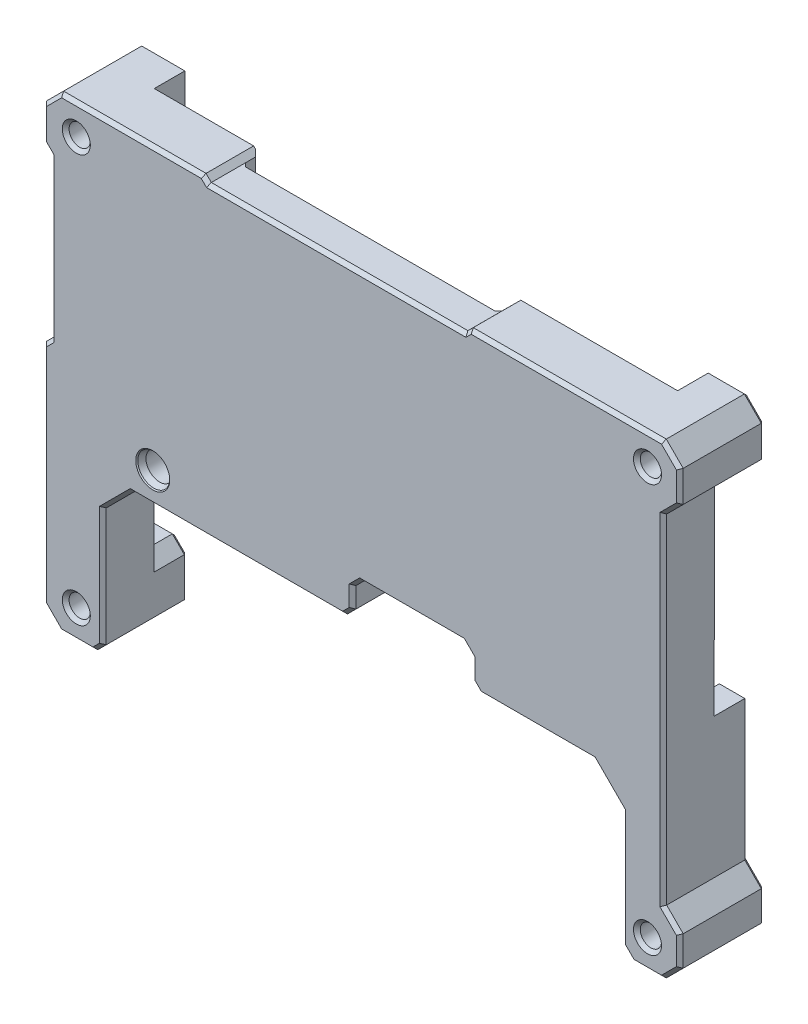
from build123d import *

# Parameters (mm, degrees)
SKETCH_1_W                = 85
SKETCH_1_H                = 65
EXTRUDE_1_DEPTH           = 10
CUT_EXTRUDE_1_REACH       = 109.471
SKETCH_2_R                = 1.25
CUT_EXTRUDE_2_REACH       = 109.471
SKETCH_3_W                = 85
SKETCH_3_H                = 65
CUT_EXTRUDE_4_REACH       = 102.464
CUT_EXTRUDE_7_DEPTH       = 6
CUT_EXTRUDE_8_DEPTH       = 6
CUT_EXTRUDE_11_DEPTH      = 4
SKETCH_8_W                = 8
SKETCH_8_H                = 5
CUT_EXTRUDE_12_DEPTH      = 1
SKETCH_10_W               = 5.4
SKETCH_10_H               = 6
SKETCH_10_W_2             = 4
EXTRUDE_2_DEPTH           = 2.040000001
SKETCH_11_W               = 4.2
SKETCH_11_H               = 5
EXTRUDE_3_DEPTH           = 1.300114616
SKETCH_12_W               = 12
SKETCH_12_H               = 6
EXTRUDE_4_DEPTH           = 1.89
SKETCH_13_W               = 3.114456334
SKETCH_13_H               = 4.982674998
EXTRUDE_5_DEPTH           = 4
SKETCH_15_W               = 14
SKETCH_15_H               = 4.4
CUT_EXTRUDE_13_DEPTH      = 6
CHAMFER_1_SIZE            = 1
CHAMFER_2_SIZE            = 0.6
CHAMFER_5_SIZE            = 0.6
CUT_EXTRUDE_14_DEPTH      = 101.144527295
CUT_EXTRUDE_14_DEPTH_BACK = 101.144527295
SKETCH_16_R               = 1.6
CUT_EXTRUDE_15_DEPTH      = 4
CUT_EXTRUDE_16_DEPTH      = 4
CHAMFER_6_SIZE            = 0.4
CHAMFER_7_SIZE            = 0.4
CHAMFER_8_SIZE            = 0.4
CHAMFER_9_SIZE            = 0.4
CHAMFER_11_SIZE           = 0.4
SKETCH_19_W               = 9.4
SKETCH_19_H               = 8.4
CUT_EXTRUDE_17_DEPTH      = 2.4
CHAMFER_12_SIZE           = 0.4
CHAMFER_13_SIZE           = 0.4


with BuildPart() as part:
    # 草图1 → 凸台-拉伸1 (new body)
    with BuildSketch(Plane.XY):
        with Locations((42.5, 32.5)):
            Rectangle(SKETCH_1_W, SKETCH_1_H)
    extrude(amount=EXTRUDE_1_DEPTH)

    # 草图2 → 切除-拉伸1 (cut, up to next)
    with BuildSketch(Plane(origin=(0, 0, 0), x_dir=(-1, 0, 0), z_dir=(0, 0, -1)), mode=Mode.PRIVATE) as cut_extrude_1_sk1:
        with Locations((-76.166921514, 56.442524765)):
            Circle(SKETCH_2_R)
    cut_extrude_1_tool1 = extrude(cut_extrude_1_sk1.sketch, amount=-CUT_EXTRUDE_1_REACH, mode=Mode.PRIVATE) & part.part
    # 草图2 → 切除-拉伸1 (cut, up to next)
    with BuildSketch(Plane(origin=(0, 0, 0), x_dir=(-1, 0, 0), z_dir=(0, 0, -1)), mode=Mode.PRIVATE) as cut_extrude_1_sk2:
        with Locations((-8.888803658, 56.442524765)):
            Circle(SKETCH_2_R)
    cut_extrude_1_tool2 = extrude(cut_extrude_1_sk2.sketch, amount=-CUT_EXTRUDE_1_REACH, mode=Mode.PRIVATE) & part.part
    # 草图2 → 切除-拉伸1 (cut, up to next)
    with BuildSketch(Plane(origin=(0, 0, 0), x_dir=(-1, 0, 0), z_dir=(0, 0, -1)), mode=Mode.PRIVATE) as cut_extrude_1_sk3:
        with Locations((-76.166921514, 8.41508509)):
            Circle(SKETCH_2_R)
    cut_extrude_1_tool3 = extrude(cut_extrude_1_sk3.sketch, amount=-CUT_EXTRUDE_1_REACH, mode=Mode.PRIVATE) & part.part
    # 草图2 → 切除-拉伸1 (cut, up to next)
    with BuildSketch(Plane(origin=(0, 0, 0), x_dir=(-1, 0, 0), z_dir=(0, 0, -1)), mode=Mode.PRIVATE) as cut_extrude_1_sk4:
        with Locations((-8.888803658, 8.41508509)):
            Circle(SKETCH_2_R)
    cut_extrude_1_tool4 = extrude(cut_extrude_1_sk4.sketch, amount=-CUT_EXTRUDE_1_REACH, mode=Mode.PRIVATE) & part.part
    add(cut_extrude_1_tool1.solids().sort_by_distance((76.166922, 56.442525, 0))[0], mode=Mode.SUBTRACT)
    add(cut_extrude_1_tool2.solids().sort_by_distance((8.888804, 56.442525, 0))[0], mode=Mode.SUBTRACT)
    add(cut_extrude_1_tool3.solids().sort_by_distance((76.166922, 8.415085, 0))[0], mode=Mode.SUBTRACT)
    add(cut_extrude_1_tool4.solids().sort_by_distance((8.888804, 8.415085, 0))[0], mode=Mode.SUBTRACT)

    # 草图3 → 切除-拉伸2 (cut, up to next)
    with BuildSketch(Plane(origin=(0, 0, 0), x_dir=(-1, 0, 0), z_dir=(0, 0, -1)), mode=Mode.PRIVATE) as cut_extrude_2_sk1:
        with Locations((-42.5, 32.5)):
            Rectangle(SKETCH_3_W, SKETCH_3_H)
        Polygon((-5, 33.462892894), (-5.871324699, 34.334217592), (-5.87504445, 53.137061214), (-5, 54.017366187), (-5, 57.982143592), (-6.992565577, 59.974709169), (-23.773560915, 59.974709169), (-24.394872914, 59.353397171), (-54.61482093, 59.349677419), (-55.245113202, 59.974709169), (-77.982184232, 59.974709169), (-79.974749809, 57.982143592), (-79.97474981, 54.295829484), (-78.032030648, 52.353110322), (-78.028310897, 12.45999492), (-79.97474981, 10.508295484), (-79.97474981, 6.992565577), (-77.982184232, 5), (-74.414239441, 5), (-73.152434681, 6.26180476), (-60.043505207, 6.265524511), (-58.772720173, 5), (-32.926479725, 5), (-31.743585303, 6.182894422), (-17.461559563, 6.186614173), (-16.269684867, 5), (-6.992565577, 5), (-5, 6.992565577), align=None, mode=Mode.SUBTRACT)
    cut_extrude_2_tool1 = extrude(cut_extrude_2_sk1.sketch, amount=-CUT_EXTRUDE_2_REACH, mode=Mode.PRIVATE) & part.part
    add(cut_extrude_2_tool1.solids().sort_by_distance((42.5, 63.929953, 0))[0], mode=Mode.SUBTRACT)

    # 草图4 → 切除-拉伸4 (cut, up to next)
    with BuildSketch(Plane(origin=(0, 0, 0), x_dir=(-1, 0, 0), z_dir=(0, 0, -1)), mode=Mode.PRIVATE) as cut_extrude_4_sk1:
        Polygon((-73.152434681, 6.26180476), (-73.152434681, 20.032317315), (-69.831576581, 23.353175415), (-46.787984184, 23.353175415), (-15.403761553, 23.353175415), (-12.014024846, 19.963438707), (-12.014024846, 6.188032983), (-12.014024846, 0.193960815), (-73.152434681, 0.193960815), align=None)
    cut_extrude_4_tool1 = extrude(cut_extrude_4_sk1.sketch, amount=-CUT_EXTRUDE_4_REACH, mode=Mode.PRIVATE) & part.part
    add(cut_extrude_4_tool1.solids().sort_by_distance((42.587983, 11.689717, 0))[0], mode=Mode.SUBTRACT)

    # 草图5 → 切除-拉伸7 (cut)
    with BuildSketch(Plane(origin=(0, 0, 0), x_dir=(-1, 0, 0), z_dir=(0, 0, -1))):
        Polygon((-24.394872914, 59.353397171), (-24.394872914, 53.906418167), (-25.526104495, 52.774908066), (-53.482640788, 52.774908066), (-54.614150889, 53.906139647), (-54.61482093, 59.349677419), align=None)
    extrude(amount=-CUT_EXTRUDE_7_DEPTH, mode=Mode.SUBTRACT)

    # 草图6 → 切除-拉伸8 (cut)
    with BuildSketch(Plane(origin=(0, 0, 0), x_dir=(-1, 0, 0), z_dir=(0, 0, -1))):
        Polygon((-5.871324699, 34.334217592), (-11.671324699, 34.334217592), (-11.671324699, 50.334217592), (-5.874489966, 50.334217592), (-5.873484235, 45.250384759), align=None)
    extrude(amount=-CUT_EXTRUDE_8_DEPTH, mode=Mode.SUBTRACT)

    # 草图7 → 切除-拉伸11 (cut)
    with BuildSketch(Plane(origin=(0, 0, 0), x_dir=(-1, 0, 0), z_dir=(0, 0, -1))):
        Polygon((-74.432117646, 51.26230094), (-76.432117646, 51.26230094), (-78.031928938, 51.26230094), (-78.029847328, 28.93771831), (-75.029847328, 28.93771831), (-75.029847328, 13.93771831), (-73.152434681, 12.060305663), (-73.152434681, 20.032317315), (-69.831576581, 23.353175415), (-15.403761553, 23.353175415), (-12.014024846, 19.963438707), (-12.014024846, 10.599811284), (-10.599811284, 12.014024847), (-6.599811284, 12.014024847), (-5, 12.014024847), (-5, 33.462892894), (-5.871324699, 34.334217592), (-11.671324699, 34.334217592), (-11.671324699, 50.334217592), (-5.874489966, 50.334217592), (-5.87504445, 53.137061214), (-9.87504445, 53.137061214), (-12.071959353, 55.333976117), (-12.071959353, 58.333976117), (-23.061659554, 58.333976117), (-23.732127818, 57.663342778), (-24.394872914, 57.663261201), (-24.394872914, 53.906418167), (-25.526104495, 52.774908066), (-53.482640788, 52.774908066), (-54.614150889, 53.906139647), (-54.61482093, 59.349677419), (-55.245113202, 59.974709169), (-71.319520701, 59.974709169), (-71.319520701, 58.374897885), (-71.319520701, 54.374897885), align=None)
    extrude(amount=-CUT_EXTRUDE_11_DEPTH, mode=Mode.SUBTRACT)

    # 草图8 → 切除-拉伸12 (cut)
    with BuildSketch(Plane(origin=(0, 0, 4), x_dir=(-1, 0, 0), z_dir=(0, 0, -1))):
        with Locations((-69.348077333, 43.45871309)):
            Rectangle(SKETCH_8_W, SKETCH_8_H)
    extrude(amount=-CUT_EXTRUDE_12_DEPTH, mode=Mode.SUBTRACT)

    # 草图10 → 凸台-拉伸2 (add)
    with BuildSketch(Plane(origin=(0, 0, 4), x_dir=(-1, 0, 0), z_dir=(0, 0, -1))):
        with Locations((-44.246532103, 31.889800214)):
            Rectangle(SKETCH_10_W, SKETCH_10_H)
        with Locations((-39.546532103, 31.889800214)):
            Rectangle(SKETCH_10_W_2, SKETCH_10_H)
        with Locations((-34.846532103, 31.889800214)):
            Rectangle(SKETCH_10_W, SKETCH_10_H)
    extrude(amount=EXTRUDE_2_DEPTH)

    # 草图11 → 凸台-拉伸3 (add)
    with BuildSketch(Plane(origin=(0, 0, 4), x_dir=(-1, 0, 0), z_dir=(0, 0, -1))):
        with Locations((-38.731800654, 41.192864876)):
            Rectangle(SKETCH_11_W, SKETCH_11_H)
    extrude(amount=EXTRUDE_3_DEPTH)

    # 草图12 → 凸台-拉伸4 (add)
    with BuildSketch(Plane(origin=(0, 0, 4), x_dir=(-1, 0, 0), z_dir=(0, 0, -1))):
        with Locations((-24.610605003, 27.685920752)):
            Rectangle(SKETCH_12_W, SKETCH_12_H)
        Polygon((-30.610605003, 30.685920752), (-24.610605003, 30.685920752), (-32.146532103, 34.889800214), (-32.146532103, 28.889800214), (-30.610605003, 27.685920752), align=None)
    extrude(amount=EXTRUDE_4_DEPTH)

    # 草图13 → 凸台-拉伸5 (add)
    with BuildSketch(Plane(origin=(0, 0, 4), x_dir=(-1, 0, 0), z_dir=(0, 0, -1))):
        with Locations((-61.333013133, 38.127509711)):
            Rectangle(SKETCH_13_W, SKETCH_13_H)
    extrude(amount=EXTRUDE_5_DEPTH)

    # 草图15 → 切除-拉伸13 (cut)
    with BuildSketch(Plane.XY.offset(10)):
        with Locations((48.428848604, 25.553175415)):
            Rectangle(SKETCH_15_W, SKETCH_15_H)
    extrude(amount=-CUT_EXTRUDE_13_DEPTH, mode=Mode.SUBTRACT)

    # 倒角1
    chamfer_1_edges = [part.edges().sort_by_distance(p)[0] for p in [
        (12.014024846, 5, 5),
        (55.428848604, 23.353175415, 7),
        (55.428848604, 27.753175415, 7),
        (41.428848604, 27.753175415, 7),
        (41.428848604, 23.353175415, 7),
    ]]
    chamfer(chamfer_1_edges, length=CHAMFER_1_SIZE)

    # 倒角2
    chamfer_2_edges = [part.edges().sort_by_distance(p)[0] for p in [
        (62.8902413, 38.127509711, 4),
        (61.333013133, 35.636172212, 4),
        (59.775784966, 38.127509711, 4),
        (61.333013133, 40.61884721, 4),
    ]]
    chamfer(chamfer_2_edges, length=CHAMFER_2_SIZE)

    # 倒角5
    chamfer_5_edges = [part.edges().sort_by_distance(p)[0] for p in [
        (38.731800654, 43.692864876, 4),
        (36.631800654, 41.192864876, 4),
        (38.731800654, 38.692864876, 4),
        (40.831800654, 41.192864876, 4),
    ]]
    chamfer(chamfer_5_edges, length=CHAMFER_5_SIZE)

    # 草图16 → 切除-拉伸14 (cut, two sides: drawn at the far end of the back side and taken through both)
    with BuildSketch(Plane(origin=(0, 0, 4), x_dir=(-1, 0, 0), z_dir=(0, 0, -1)).offset(-CUT_EXTRUDE_14_DEPTH_BACK)):
        with Locations((-17.894129073, 26.946261069)):
            Circle(SKETCH_16_R)
    extrude(amount=CUT_EXTRUDE_14_DEPTH + CUT_EXTRUDE_14_DEPTH_BACK, mode=Mode.SUBTRACT)

    # 草图17 → 切除-拉伸15 (cut)
    with BuildSketch(Plane(origin=(0, 0, 0), x_dir=(-1, 0, 0), z_dir=(0, 0, -1))):
        Polygon((-23.061659554, 58.333976117), (-12.071959353, 58.333976117), (-12.071959353, 59.974709169), (-23.773560915, 59.974709169), (-24.394872914, 59.353397171), (-24.394872914, 57.663261201), (-23.732127818, 57.663342778), align=None)
    extrude(amount=-CUT_EXTRUDE_15_DEPTH, mode=Mode.SUBTRACT)

    # 草图18 → 切除-拉伸16 (cut)
    with BuildSketch(Plane(origin=(0, 0, 0), x_dir=(-1, 0, 0), z_dir=(0, 0, -1))):
        Polygon((-71.319520701, 59.974709169), (-73.719520701, 59.974709169), (-73.719520701, 54.050166597), (-75.416576976, 52.353110322), (-78.032030648, 52.353110322), (-78.031928938, 51.26230094), (-74.432117646, 51.26230094), (-71.319520701, 54.374897885), align=None)
    extrude(amount=-CUT_EXTRUDE_16_DEPTH, mode=Mode.SUBTRACT)

    # 倒角6
    chamfer_6_edges = [part.edges().sort_by_distance(p)[0] for p in [
        (73.152434681, 13.147061037, 10),
        (71.492005631, 21.692746365, 10),
        (63.130212592, 23.353175415, 10),
        (13.7088932, 21.658307061, 10),
        (12.014024846, 12.981719354, 10),
        (10.138803658, 56.442524765, 10),
        (77.416921514, 8.41508509, 10),
        (10.138803658, 8.41508509, 10),
        (77.416921514, 56.442524765, 10),
        (48.428848604, 27.753175415, 10),
        (55.428848604, 25.553175415, 10),
        (27.916305079, 23.353175415, 10),
        (41.428848604, 25.553175415, 10),
        (55.928848604, 23.853175415, 10),
        (40.928848604, 23.853175415, 10),
        (11.514024846, 5.5, 10),
        (41.928848604, 27.253175415, 10),
        (54.928848604, 27.253175415, 10),
        (19.494129073, 26.946261069, 10),
        (5.873184574, 43.735639403, 10),
        (5.435662349, 33.898555243, 10),
        (5, 20.227729235, 10),
        (5.996282789, 5.996282789, 10),
        (9.003295212, 5, 10),
        (73.783337061, 5.63090238, 10),
        (76.198211836, 5, 10),
        (78.978467021, 5.996282789, 10),
        (79.97474981, 8.750430531, 10),
        (79.001530353, 11.484145202, 10),
        (78.030170772, 32.406552621, 10),
        (79.003390229, 53.324469903, 10),
        (79.974749809, 56.138986538, 10),
        (78.978467021, 58.978426381, 10),
        (66.613648717, 59.974709169, 10),
        (54.929967066, 59.662193294, 10),
        (39.504846922, 59.351537295, 10),
        (24.084216914, 59.66405317, 10),
        (15.383063246, 59.974709169, 10),
        (5.996282789, 58.978426381, 10),
        (5, 55.99975489, 10),
        (5.437522225, 53.577213701, 10),
    ]]
    chamfer(chamfer_6_edges, length=CHAMFER_6_SIZE)

    # 倒角7
    chamfer_7_edges = [part.edges().sort_by_distance(p)[0] for p in [
        (10.138803658, 56.442524765, 0),
        (73.152434681, 9.161055212, 0),
        (78.029079112, 20.698856615, 0),
        (77.416921514, 8.41508509, 0),
        (7.799905642, 12.014024847, 0),
        (11.306918066, 11.306918066, 0),
        (74.091141004, 12.999011987, 0),
        (12.071959353, 57.654342643, 0),
        (10.973501901, 54.235518665, 0),
        (7.87504445, 53.137061214, 0),
        (10.138803658, 8.41508509, 0),
        (76.529847328, 28.93771831, 0),
        (75.029847328, 21.43771831, 0),
        (77.416921514, 56.442524765, 0),
        (38.731800654, 43.692864876, 2.699885384),
        (36.631800654, 41.192864876, 2.699885384),
        (38.731800654, 38.692864876, 2.699885384),
        (40.831800654, 41.192864876, 2.699885384),
        (61.333013133, 40.61884721, 0),
        (62.8902413, 38.127509711, 0),
        (61.333013133, 35.636172212, 0),
        (59.775784966, 38.127509711, 0),
        (9.003295212, 5, 0),
        (12.014024846, 8.299905642, 0),
        (11.514024846, 5.5, 0),
        (75.850852466, 59.974709169, 0),
        (74.568048838, 53.20163846, 0),
        (76.724303812, 52.353110322, 0),
        (73.719520701, 57.012437883, 0),
        (5, 9.503295212, 0),
        (5.996282789, 5.996282789, 0),
        (73.783337061, 5.63090238, 0),
        (76.198211836, 5, 0),
        (78.978467021, 5.996282789, 0),
        (79.97474981, 8.750430531, 0),
        (79.001530353, 11.484145202, 0),
        (79.003390229, 53.324469903, 0),
        (79.974749809, 56.138986538, 0),
        (78.978467021, 58.978426381, 0),
        (9.532262465, 59.974709169, 0),
        (5.996282789, 58.978426381, 0),
        (5, 55.99975489, 0),
        (5.437522225, 53.577213701, 0),
    ]]
    chamfer(chamfer_7_edges, length=CHAMFER_7_SIZE)

    # 倒角8
    chamfer_8_edges = [part.edges().sort_by_distance(p)[0] for p in [
        (8.771324699, 34.334217592, 6),
        (11.671324699, 42.334217592, 6),
        (11.671324699, 34.334217592, 5),
        (8.772907332, 50.334217592, 6),
        (11.671324699, 50.334217592, 5),
        (8.772907332, 50.334217592, 4),
        (11.671324699, 42.334217592, 4),
        (8.771324699, 34.334217592, 4),
    ]]
    chamfer(chamfer_8_edges, length=CHAMFER_8_SIZE)

    # 倒角9
    chamfer_9_edges = [part.edges().sort_by_distance(p)[0] for p in [
        (24.394872914, 56.629907669, 6),
        (24.960488704, 53.340663116, 6),
        (39.504372641, 52.774908066, 6),
        (54.048395838, 53.340523857, 6),
        (54.614485909, 56.627908533, 6),
        (54.614485909, 56.627908533, 4),
        (54.048395838, 53.340523857, 4),
        (39.504372641, 52.774908066, 4),
        (24.960488704, 53.340663116, 4),
        (24.394872914, 56.629907669, 4),
    ]]
    chamfer(chamfer_9_edges, length=CHAMFER_9_SIZE)

    # 倒角11
    chamfer_11_edges = [part.edges().sort_by_distance(p)[0] for p in [
        (73.348077333, 43.45871309, 5),
        (69.348077333, 45.95871309, 5),
        (65.348077333, 43.45871309, 5),
        (69.348077333, 40.95871309, 5),
    ]]
    chamfer(chamfer_11_edges, length=CHAMFER_11_SIZE)

    # 草图19 → 切除-拉伸17 (cut)
    with BuildSketch(Plane(origin=(0, 0, 4), x_dir=(-1, 0, 0), z_dir=(0, 0, -1))):
        with Locations((-62.931576581, 27.553175415)):
            Rectangle(SKETCH_19_W, SKETCH_19_H)
    extrude(amount=-CUT_EXTRUDE_17_DEPTH, mode=Mode.SUBTRACT)

    # 倒角12
    chamfer_12_edges = [part.edges().sort_by_distance(p)[0] for p in [
        (67.631576581, 27.553175415, 6.4),
        (67.631576581, 23.353175415, 5.2),
        (62.931576581, 31.753175415, 6.4),
        (67.631576581, 31.753175415, 5.2),
        (58.231576581, 27.553175415, 6.4),
        (58.231576581, 31.753175415, 5.2),
        (62.931576581, 23.353175415, 6.4),
        (58.231576581, 23.353175415, 5.2),
        (67.631576581, 27.553175415, 4),
        (58.231576581, 27.553175415, 4),
        (62.931576581, 31.753175415, 4),
    ]]
    chamfer(chamfer_12_edges, length=CHAMFER_12_SIZE)

    # 倒角13
    # the kernel refuses this chamfer: 0.4 mm, written as the material it takes off along each edge
    with BuildSketch(Plane(origin=(18.610605003, 25.515645033, 0.623845995), x_dir=(0, -1, 0), z_dir=(0, 0, 1))) as chamfer_13_piece_1:
        with BuildLine():
            Line((CHAMFER_13_SIZE, 0), (-0.349058965, 0.462606044))
            ThreePointArc((-0.349058965, 0.462606044), (-0.157999055, 0.253290032), (0, 0))
            Line((0, 0), (CHAMFER_13_SIZE, 0))
        make_face()
    extrude(amount=3.376154005, mode=Mode.SUBTRACT)
    with BuildSketch(Plane(origin=(18.610605003, 28.376877105, 0.623845995), x_dir=(0, 1, 0), z_dir=(0, 0, 1))) as chamfer_13_piece_2:
        with BuildLine():
            Line((CHAMFER_13_SIZE, 0), (-0.349058965, -0.462606044))
            ThreePointArc((-0.349058965, -0.462606044), (-0.157999055, -0.253290032), (0, 0))
            Line((0, 0), (CHAMFER_13_SIZE, 0))
        make_face()
    extrude(amount=3.376154005, mode=Mode.SUBTRACT)
    with BuildSketch(Plane(origin=(17.894129073, 26.946261069, 4), x_dir=(0.8946534171346534, -0.44676085684545797, 0), z_dir=(0.44676085684545797, 0.8946534171346534, 0))) as chamfer_13_piece_3_section:
        Polygon((1.6 + CHAMFER_13_SIZE, 0), (1.6, -CHAMFER_13_SIZE), (1.6, 0), align=None)
    chamfer_13_piece_3 = revolve(axis=Axis((17.894129073, 26.946261069, 4), (0, 0, -1)), revolution_arc=153.463946973, mode=Mode.PRIVATE)
    chamfer_13_piece_3 = split(chamfer_13_piece_3, bisect_by=Plane(origin=(18.610605003, 26.946261069, 4), z_dir=(-1, 0, 0)), keep=Keep.TOP, mode=Mode.PRIVATE)
    add(chamfer_13_piece_3, mode=Mode.SUBTRACT)
    with BuildSketch(Plane(origin=(17.894129073, 26.946261069, 2.11), x_dir=(-0.1781765216764738, -0.9839985402038325, 0), z_dir=(-0.9839985402038325, 0.1781765216764738, 0))) as chamfer_13_piece_4:
        Polygon((1.6, CHAMFER_13_SIZE), (1.6 + CHAMFER_13_SIZE, 0), (1.6, 0), align=None)
    revolve(axis=Axis((17.894129073, 26.946261069, 2.11), (0, 0, 1)), revolution_arc=200.527130665, mode=Mode.SUBTRACT)
    with BuildSketch(Plane(origin=(17.894129073, 26.946261069, 9.6), x_dir=(-1, 0, 0), z_dir=(0, -1, 0))) as chamfer_13_piece_5:
        Polygon((1.6, CHAMFER_13_SIZE), (1.6 + CHAMFER_13_SIZE * 0.707106781187, -CHAMFER_13_SIZE * 0.707106781187), (1.6, 0), align=None)
    revolve(axis=Axis((17.894129073, 26.946261069, 9.6), (0, 0, -1)), mode=Mode.SUBTRACT)
    with BuildSketch(Plane(origin=(17.894129073, 26.946261069, 4), x_dir=(-1, 0, 0), z_dir=(0, -1, 0))) as chamfer_13_piece_6_section:
        Polygon((1.6 + CHAMFER_13_SIZE, 0), (1.6, -CHAMFER_13_SIZE), (1.6, 0), align=None)
    chamfer_13_piece_6 = revolve(axis=Axis((17.894129073, 26.946261069, 4), (0, 0, -1)), revolution_arc=153.463946973, mode=Mode.PRIVATE)
    chamfer_13_piece_6 = split(chamfer_13_piece_6, bisect_by=Plane(origin=(18.610605003, 26.946261069, 4), z_dir=(-1, 0, 0)), keep=Keep.TOP, mode=Mode.PRIVATE)
    add(chamfer_13_piece_6, mode=Mode.SUBTRACT)
    with BuildSketch(Plane(origin=(17.894129073, 26.946261069, 4), x_dir=(0.8946534171346534, -0.44676085684545797, 0), z_dir=(0.44676085684545797, 0.8946534171346534, 0))) as chamfer_13_piece_7a_section:
        Polygon((1.6 + CHAMFER_13_SIZE, 0), (1.6, -CHAMFER_13_SIZE), (1.6, 0), align=None)
    chamfer_13_piece_7a = revolve(axis=Axis((17.894129073, 26.946261069, 4), (0, 0, -1)), revolution_arc=153.463946973, mode=Mode.PRIVATE)
    chamfer_13_piece_7a = split(chamfer_13_piece_7a, bisect_by=Plane(origin=(18.610605003, 26.946261069, 4), z_dir=(1, 0, 0)), keep=Keep.TOP, mode=Mode.PRIVATE)
    with BuildSketch(Plane(origin=(18.610605003, 25.515645033, 0.623845995), x_dir=(0, -1, 0), z_dir=(0, 0, 1))) as chamfer_13_piece_7b_section:
        with BuildLine():
            Line((CHAMFER_13_SIZE, 0), (-0.349058965, 0.462606044))
            ThreePointArc((-0.349058965, 0.462606044), (-0.157999055, 0.253290032), (0, 0))
            Line((0, 0), (CHAMFER_13_SIZE, 0))
        make_face()
    chamfer_13_piece_7b = extrude(amount=4.86230801, mode=Mode.PRIVATE)
    chamfer_13_piece_7b = split(chamfer_13_piece_7b, bisect_by=Plane(origin=(18.610605003, 25.515645033, 4), z_dir=(0, 0, 1)), keep=Keep.TOP, mode=Mode.PRIVATE)
    chamfer_13_piece_7 = chamfer_13_piece_7a & chamfer_13_piece_7b
    add(chamfer_13_piece_7, mode=Mode.SUBTRACT)
    with BuildSketch(Plane(origin=(17.894129073, 26.946261069, 4), x_dir=(-1, 0, 0), z_dir=(0, -1, 0))) as chamfer_13_piece_8a_section:
        Polygon((1.6 + CHAMFER_13_SIZE, 0), (1.6, -CHAMFER_13_SIZE), (1.6, 0), align=None)
    chamfer_13_piece_8a = revolve(axis=Axis((17.894129073, 26.946261069, 4), (0, 0, -1)), revolution_arc=153.463946973, mode=Mode.PRIVATE)
    chamfer_13_piece_8a = split(chamfer_13_piece_8a, bisect_by=Plane(origin=(18.610605003, 26.946261069, 4), z_dir=(1, 0, 0)), keep=Keep.TOP, mode=Mode.PRIVATE)
    with BuildSketch(Plane(origin=(18.610605003, 28.376877105, 0.623845995), x_dir=(0, 1, 0), z_dir=(0, 0, 1))) as chamfer_13_piece_8b_section:
        with BuildLine():
            Line((CHAMFER_13_SIZE, 0), (-0.349058965, -0.462606044))
            ThreePointArc((-0.349058965, -0.462606044), (-0.157999055, -0.253290032), (0, 0))
            Line((0, 0), (CHAMFER_13_SIZE, 0))
        make_face()
    chamfer_13_piece_8b = extrude(amount=4.86230801, mode=Mode.PRIVATE)
    chamfer_13_piece_8b = split(chamfer_13_piece_8b, bisect_by=Plane(origin=(18.610605003, 28.376877105, 4), z_dir=(0, 0, 1)), keep=Keep.TOP, mode=Mode.PRIVATE)
    chamfer_13_piece_8 = chamfer_13_piece_8a & chamfer_13_piece_8b
    add(chamfer_13_piece_8, mode=Mode.SUBTRACT)


solid = part.part
